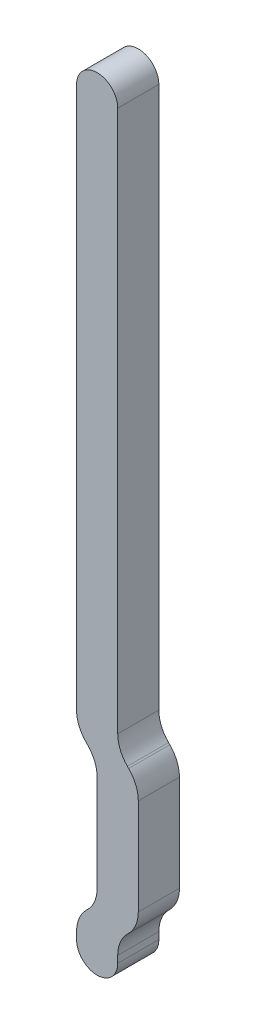
from build123d import *

# Parameters (mm, degrees)
EXTRUDE_1_DEPTH = 10
FILLET_1_R      = 8


with BuildPart() as part:
    # 草图1 → 凸台-拉伸1 (new body)
    with BuildSketch(Plane.XY):
        with BuildLine():
            Line((-5, -175), (-5, -180))
            ThreePointArc((-5, -180), (0, -185), (5, -180))
            Line((5, -180), (5, -175))
            Line((5, -175), (10, -170))
            Line((10, -170), (10, -140))
            Line((10, -140), (5, -135))
            Line((5, -135), (5, 0))
            ThreePointArc((5, 0), (0, 5), (-5, 0))
            Line((-5, 0), (-5, -135))
            Line((-5, -135), (0, -140))
            Line((0, -140), (0, -170))
            Line((0, -170), (-5, -175))
        make_face()
    extrude(amount=EXTRUDE_1_DEPTH)

    # 圆角1
    fillet_1_edges = [part.edges().sort_by_distance(p)[0] for p in [
        (-5, -135, 5),
        (0, -140, 5),
        (0, -170, 5),
        (-5, -175, 5),
        (5, -175, 5),
        (10, -170, 5),
        (10, -140, 5),
        (5, -135, 5),
    ]]
    fillet(fillet_1_edges, radius=FILLET_1_R)


solid = part.part
